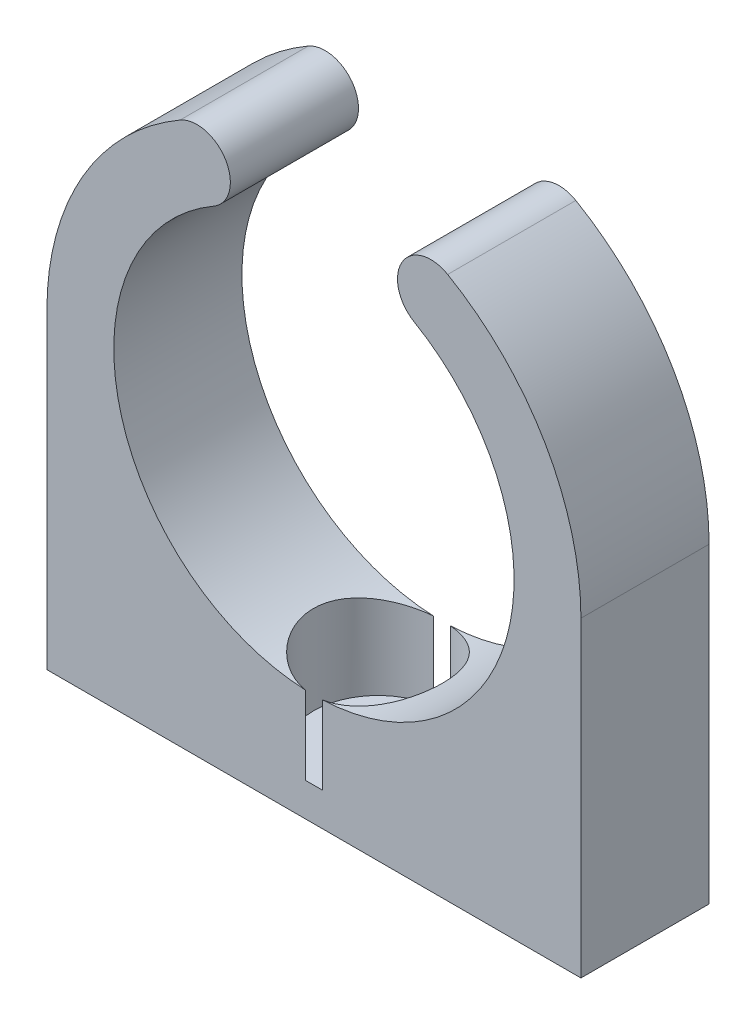
from build123d import *

# Parameters (mm, degrees)
BOSS_EXTRUDE1_DEPTH = 2.875


with BuildPart() as part:
    # Sketch1 → Boss-Extrude1 (new, symmetric)
    with BuildSketch(Plane.XY):
        with BuildLine():
            Line((-11.98, 0), (-11.98, -13.98))
            Line((-11.98, -13.98), (11.98, -13.98))
            Line((11.98, -13.98), (11.98, 0))
            ThreePointArc((11.98, 0), (10.378283744, 5.984281622), (6.001431298, 10.368376072))
            ThreePointArc((6.001431298, 10.368376072), (3.951789306, 9.821596677), (4.498568702, 7.771954685))
            ThreePointArc((4.498568702, 7.771954685), (4.485713603, -7.779381304), (-8.98, 0))
            ThreePointArc((-8.98, 0), (-7.779381304, 4.485713603), (-4.498568702, 7.771954685))
            ThreePointArc((-4.498568702, 7.771954685), (-3.951789306, 9.821596677), (-6.001431298, 10.368376072))
            ThreePointArc((-6.001431298, 10.368376072), (-10.378283744, 5.984281622), (-11.98, 0))
        make_face()
    extrude(amount=BOSS_EXTRUDE1_DEPTH, both=True)

    # Sketch4 one side → Cut-Revolve1 (revolve, cut)
    with BuildSketch(Plane.XY):
        Polygon((-1.5, -13.98), (0, -13.98), (0, -7.48), (-2.9, -7.48), (-2.9, -12.48), (-1.5, -12.48), align=None)
    revolve(axis=Axis((0, -13.98, 0), (0, 1, 0)), mode=Mode.SUBTRACT)


solid = part.part
